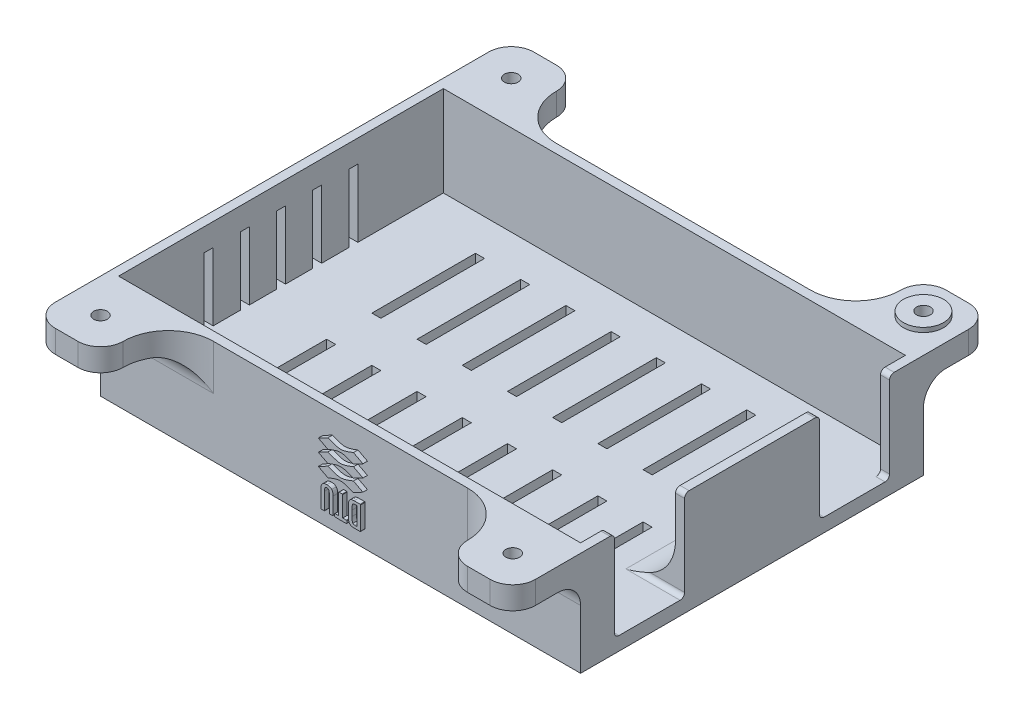
from build123d import *
from OCP.BRepFilletAPI import BRepFilletAPI_MakeFillet

# Parameters (mm, degrees)
SKETCH1_W               = 106.2
SKETCH1_H               = 75.85
BOSS_EXTRUDE1_DEPTH     = 23
SKETCH5_W               = 15
SKETCH5_H               = 15
FEET_DEPTH              = 5
SKETCH2_W               = 102.2
SKETCH2_H               = 71.85
CUT_EXTRUDE1_DEPTH      = 20
LEFTHOLESSKETCH_W       = 15.5
LEFTHOLESSKETCH_H       = 20
LEFTHOLES_DEPTH         = 2
RIGHTHOLESSKETCH_W      = 2
RIGHTHOLESSKETCH_H      = 15
RIGHTHOLES_DEPTH        = 10
FILLET1_R               = 10
FILLET1_R_2             = 5
SKETCH6_6_R             = 4.45
BOSS_EXTRUDE4_DEPTH     = 1
CUT_EXTRUDE9_DEPTH      = 108.193263345
CUT_EXTRUDE9_DEPTH_BACK = 5
SKETCH6_R               = 1.525
SKETCH7_R               = 3.5
CUT_EXTRUDE10_DEPTH     = 10
SKETCH8_W               = 2
SKETCH8_H               = 22.925
CUT_EXTRUDE11_DEPTH     = 10
FILLET3_R1              = 1
FILLET3_R2              = 10
DTU_SIDE_DEPTH          = 1
BOSS_EXTRUDE6_DEPTH     = 1


with BuildPart() as part:
    # Sketch1 → Boss-Extrude1 (new body)
    with BuildSketch(Plane(origin=(0, 0, 0), x_dir=(1, 0, 0), z_dir=(0, 1, 0))):
        with Locations((-14.601149425, -26.937068966)):
            Rectangle(SKETCH1_W, SKETCH1_H)
    extrude(amount=BOSS_EXTRUDE1_DEPTH)

    # Sketch5 → Feet (add)
    with BuildSketch(Plane.XZ.offset(-23)):
        with Locations((30.998850575, -18.487931034)):
            Rectangle(SKETCH5_W, SKETCH5_H)
        with Locations((30.998850575, 72.362068966)):
            Rectangle(SKETCH5_W, SKETCH5_H)
        with Locations((-60.201149425, 72.362068966)):
            Rectangle(SKETCH5_W, SKETCH5_H)
        with Locations((-60.201149425, -18.487931034)):
            Rectangle(SKETCH5_W, SKETCH5_H)
    extrude(amount=FEET_DEPTH)

    # Sketch2 → Cut-Extrude1 (cut)
    with BuildSketch(Plane(origin=(0, 23, 0), x_dir=(1, 0, 0), z_dir=(0, 1, 0))):
        with Locations((-14.601149425, -26.937068966)):
            Rectangle(SKETCH2_W, SKETCH2_H)
    extrude(amount=-CUT_EXTRUDE1_DEPTH, mode=Mode.SUBTRACT)

    # LeftHolesSketch → LeftHoles (cut)
    with BuildSketch(Plane(origin=(38.498850575, 0, 0), x_dir=(0, 0, -1), z_dir=(1, 0, 0))):
        with Locations((-49.612068966, 13)):
            Rectangle(LEFTHOLESSKETCH_W, LEFTHOLESSKETCH_H)
        with Locations((-4.262068966, 13)):
            Rectangle(LEFTHOLESSKETCH_W, LEFTHOLESSKETCH_H)
    extrude(amount=-LEFTHOLES_DEPTH, mode=Mode.SUBTRACT)

    # RightHolesSketch → RightHoles (cut)
    with BuildSketch(Plane.ZY.offset(67.701149425)):
        with Locations((34.937068966, 10.5)):
            Rectangle(RIGHTHOLESSKETCH_W, RIGHTHOLESSKETCH_H)
        with Locations((26.937068966, 10.5)):
            Rectangle(RIGHTHOLESSKETCH_W, RIGHTHOLESSKETCH_H)
        with Locations((42.937068966, 10.5)):
            Rectangle(RIGHTHOLESSKETCH_W, RIGHTHOLESSKETCH_H)
        with Locations((18.937068966, 10.5)):
            Rectangle(RIGHTHOLESSKETCH_W, RIGHTHOLESSKETCH_H)
        with Locations((10.937068966, 10.5)):
            Rectangle(RIGHTHOLESSKETCH_W, RIGHTHOLESSKETCH_H)
    extrude(amount=-RIGHTHOLES_DEPTH, mode=Mode.SUBTRACT)

    # Fillet1
    fillet1_edges_1 = [part.edges().sort_by_distance(p)[0] for p in [
        (23.498850575, 20.5, -10.987931034),
        (-52.701149425, 20.5, -10.987931034),
        (-52.701149425, 20.5, 64.862068966),
        (23.498850575, 20.5, 64.862068966),
    ]]
    fillet1_edges_2 = [part.edges().sort_by_distance(p)[0] for p in [
        (23.498850575, 20.5, -25.987931034),
        (38.498850575, 20.5, -25.987931034),
        (-52.701149425, 20.5, 79.862068966),
        (-67.701149425, 20.5, 79.862068966),
        (23.498850575, 20.5, 79.862068966),
        (38.498850575, 20.5, 79.862068966),
        (-52.701149425, 20.5, -25.987931034),
        (-67.701149425, 20.5, -25.987931034),
        (-60.201149425, 18, -10.987931034),
        (30.998850575, 18, -10.987931034),
        (30.998850575, 18, 64.862068966),
        (-60.201149425, 18, 64.862068966),
    ]]
    fillet1 = BRepFilletAPI_MakeFillet(part.part.solid().wrapped)
    for e in fillet1_edges_1:
        fillet1.Add(FILLET1_R - 0.0001, e.wrapped)
    for e in fillet1_edges_2:
        fillet1.Add(FILLET1_R_2 - 0.0001, e.wrapped)
    add(Compound.cast(fillet1.Shape()), mode=Mode.REPLACE)  # a hair under: the kernel refuses the full size

    # Sketch6<6> → Boss-Extrude4 (add)
    with BuildSketch(Plane(origin=(0, 23, 0), x_dir=(-1, 0, 0), z_dir=(0, -1, 0))):
        with Locations(Location((-30.998850575, 18.487931034, 0), (0, 0, 90))):
            Circle(SKETCH6_6_R)
    extrude(amount=-BOSS_EXTRUDE4_DEPTH)

    # Sketch6 → Cut-Extrude9 (cut, two sides: drawn at the far end of the back side and taken through both)
    with BuildSketch(Plane(origin=(0, 23, 0), x_dir=(-1, 0, 0), z_dir=(0, -1, 0)).offset(-CUT_EXTRUDE9_DEPTH_BACK)):
        with Locations(Location((-30.998850575, 18.487931034, 0), (0, 0, 90))):
            Circle(SKETCH6_R)
        with Locations(Location((-30.998850575, -72.362068966, 0), (0, 0, 90))):
            Circle(SKETCH6_R)
        with Locations(Location((60.201149425, -72.362068966, 0), (0, 0, 270))):
            Circle(SKETCH6_R)
        with Locations(Location((60.201149425, 18.487931034, 0), (0, 0, 90))):
            Circle(SKETCH6_R)
    extrude(amount=CUT_EXTRUDE9_DEPTH + CUT_EXTRUDE9_DEPTH_BACK, mode=Mode.SUBTRACT)

    # Sketch7 → Cut-Extrude10 (cut)
    with BuildSketch(Plane.XZ.offset(-18)):
        with Locations((-60.201149425, 72.362068966)):
            Circle(SKETCH7_R)
        with Locations((30.998850575, 72.362068966)):
            Circle(SKETCH7_R)
        with Locations((30.998850575, -18.487931034)):
            Circle(SKETCH7_R)
        with Locations((-60.201149425, -18.487931034)):
            Circle(SKETCH7_R)
    extrude(amount=CUT_EXTRUDE10_DEPTH, mode=Mode.SUBTRACT)

    # Sketch8 → Cut-Extrude11 (cut)
    with BuildSketch(Plane.XZ):
        with Locations((20.398850575, 10.474568966)):
            Rectangle(SKETCH8_W, SKETCH8_H)
        with Locations((10.398850575, 10.474568966)):
            Rectangle(SKETCH8_W, SKETCH8_H)
        with Locations((0.398850575, 10.474568966)):
            Rectangle(SKETCH8_W, SKETCH8_H)
        with Locations((-9.601149425, 10.474568966)):
            Rectangle(SKETCH8_W, SKETCH8_H)
        with Locations((-19.601149425, 10.474568966)):
            Rectangle(SKETCH8_W, SKETCH8_H)
        with Locations((-29.601149425, 10.474568966)):
            Rectangle(SKETCH8_W, SKETCH8_H)
        with Locations((-39.601149425, 10.474568966)):
            Rectangle(SKETCH8_W, SKETCH8_H)
        with Locations((-49.601149425, 10.474568966)):
            Rectangle(SKETCH8_W, SKETCH8_H)
        with Locations((10.398850575, 43.404568966)):
            Rectangle(SKETCH8_W, SKETCH8_H)
        with Locations((0.398850575, 43.404568966)):
            Rectangle(SKETCH8_W, SKETCH8_H)
        with Locations((-9.601149425, 43.404568966)):
            Rectangle(SKETCH8_W, SKETCH8_H)
        with Locations((-19.601149425, 43.404568966)):
            Rectangle(SKETCH8_W, SKETCH8_H)
        with Locations((-29.601149425, 43.404568966)):
            Rectangle(SKETCH8_W, SKETCH8_H)
        with Locations((-39.601149425, 43.404568966)):
            Rectangle(SKETCH8_W, SKETCH8_H)
        with Locations((-49.601149425, 43.404568966)):
            Rectangle(SKETCH8_W, SKETCH8_H)
        with Locations((20.398850575, 43.404568966)):
            Rectangle(SKETCH8_W, SKETCH8_H)
    extrude(amount=-CUT_EXTRUDE11_DEPTH, mode=Mode.SUBTRACT)

    # Fillet3: one fillet with a radius per group of edges: ONE call of the kernel's fillet builder (fillet() takes one radius for all edges)
    fillet3_edges_1 = [part.edges().sort_by_distance(p)[0] for p in [
        (37.498850575, 23, 41.862068966),
        (37.498850575, 3, 41.862068966),
        (37.498850575, 3, 57.362068966),
        (37.498850575, 23, 57.362068966),
        (37.498850575, 3, 12.012068966),
        (37.498850575, 23, 12.012068966),
        (37.498850575, 23, -3.487931034),
        (37.498850575, 3, -3.487931034),
    ]]
    fillet3_edges_2 = [part.edges().sort_by_distance(p)[0] for p in [
        (36.498850575, 3, 26.937068966),
    ]]
    fillet3 = BRepFilletAPI_MakeFillet(part.part.solid().wrapped)
    for e in fillet3_edges_1:
        fillet3.Add(FILLET3_R1, e.wrapped)
    for e in fillet3_edges_2:
        fillet3.Add(FILLET3_R2, e.wrapped)
    add(Compound.cast(fillet3.Shape()), mode=Mode.REPLACE)

    # Sketch9 → DTU-Side (add)
    # profile 1 of 6: a face of its own
    with BuildSketch(Plane(origin=(31.128581926, 28.357931034, 64.862068966), x_dir=(1, 0, 0), z_dir=(0, 0, -1))):
        with BuildLine():
            Line((-47.544621848, 17.835373678), (-49.644090597, 16.732557272))
            Line((-49.644090597, 16.732557272), (-47.544621848, 15.631229147))
            add(Edge.make_bspline(
                [(-47.544621848, 15.631229147), (-44.826524192, 16.688404928), (-44.597080833, 16.688404928), (-41.87799099, 15.631229147)],
                knots=[1, 1, 1, 1, 2, 2, 2, 2], degree=3))
            Line((-41.87799099, 15.631229147), (-39.779018334, 16.732557272))
            Line((-39.779018334, 16.732557272), (-41.87799099, 17.835373678))
            add(Edge.make_bspline(
                [(-41.87799099, 17.835373678), (-44.597080833, 16.777701803), (-44.826524192, 16.777701803), (-47.544621848, 17.835373678)],
                knots=[4, 4, 4, 4, 5, 5, 5, 5], degree=3))
        make_face()
    # profile 2 of 6: a face of its own
    with BuildSketch(Plane(origin=(31.128581926, 28.357931034, 64.862068966), x_dir=(1, 0, 0), z_dir=(0, 0, -1))):
        with BuildLine():
            Line((-47.544621848, 15.110826804), (-49.644090597, 14.009002585))
            Line((-49.644090597, 14.009002585), (-47.544621848, 12.906682273))
            add(Edge.make_bspline(
                [(-47.544621848, 12.906682273), (-44.826524192, 13.964354148), (-44.597080833, 13.964354148), (-41.87799099, 12.906682273)],
                knots=[1, 1, 1, 1, 2, 2, 2, 2], degree=3))
            Line((-41.87799099, 12.906682273), (-39.779018334, 14.009002585))
            Line((-39.779018334, 14.009002585), (-41.87799099, 15.110826804))
            add(Edge.make_bspline(
                [(-41.87799099, 15.110826804), (-44.597080833, 14.053651023), (-44.826524192, 14.053651023), (-47.544621848, 15.110826804)],
                knots=[4, 4, 4, 4, 5, 5, 5, 5], degree=3))
        make_face()
    # profile 3 of 6: a face of its own
    with BuildSketch(Plane(origin=(31.128581926, 28.357931034, 64.862068966), x_dir=(1, 0, 0), z_dir=(0, 0, -1))):
        with BuildLine():
            Line((-47.544621848, 12.386776023), (-49.644090597, 11.284951805))
            Line((-49.644090597, 11.284951805), (-47.544621848, 10.183127586))
            add(Edge.make_bspline(
                [(-47.544621848, 10.183127586), (-44.826524192, 11.240303367), (-44.597080833, 11.240303367), (-41.87799099, 10.183127586)],
                knots=[1, 1, 1, 1, 2, 2, 2, 2], degree=3))
            Line((-41.87799099, 10.183127586), (-39.779018334, 11.284951805))
            Line((-39.779018334, 11.284951805), (-41.87799099, 12.386776023))
            add(Edge.make_bspline(
                [(-41.87799099, 12.386776023), (-44.597080833, 11.329104149), (-44.826524192, 11.329104149), (-47.544621848, 12.386776023)],
                knots=[4, 4, 4, 4, 5, 5, 5, 5], degree=3))
        make_face()
    # profile 4 of 6: a face of its own
    with BuildSketch(Plane(origin=(31.128581926, 28.357931034, 64.862068966), x_dir=(1, 0, 0), z_dir=(0, 0, -1))):
        with BuildLine():
            Line((-41.723705834, 24.573815083), (-40.414018334, 24.573815083))
            add(Edge.make_bspline(
                [(-40.414018334, 24.573815083), (-40.374826928, 24.573815083), (-40.350766381, 24.561908833), (-40.333155053, 24.545041645)],
                knots=[0, 0, 0, 0, 1, 1, 1, 1], degree=3))
            add(Edge.make_bspline(
                [(-40.333155053, 24.545041645), (-40.315791772, 24.52718227), (-40.304381615, 24.503865864), (-40.304381615, 24.464178364)],
                knots=[1, 1, 1, 1, 2, 2, 2, 2], degree=3))
            Line((-40.304381615, 24.464178364), (-40.304381615, 19.45760024))
            add(Edge.make_bspline(
                [(-40.304381615, 19.45760024), (-40.304381615, 19.418408834), (-40.315791772, 19.394596334), (-40.333155053, 19.377233053)],
                knots=[3, 3, 3, 3, 4, 4, 4, 4], degree=3))
            add(Edge.make_bspline(
                [(-40.333155053, 19.377233053), (-40.350766381, 19.359869772), (-40.374826928, 19.347963522), (-40.414018334, 19.347963522)],
                knots=[4, 4, 4, 4, 5, 5, 5, 5], degree=3))
            Line((-40.414018334, 19.347963522), (-41.723705834, 19.347963522))
            add(Edge.make_bspline(
                [(-41.723705834, 19.347963522), (-42.232449974, 19.347963522), (-42.542756615, 19.463553365), (-42.730776146, 19.707135396)],
                knots=[6, 6, 6, 6, 7, 7, 7, 7], degree=3))
            add(Edge.make_bspline(
                [(-42.730776146, 19.707135396), (-43.008340599, 20.039518209), (-43.017270286, 20.576291646), (-43.017270286, 21.399311177)],
                knots=[7, 7, 7, 7, 8, 8, 8, 8], degree=3))
            Line((-43.017270286, 21.399311177), (-43.017270286, 22.522467427))
            add(Edge.make_bspline(
                [(-43.017270286, 22.522467427), (-43.017270286, 23.345486958), (-43.008340599, 23.882260395), (-42.730776146, 24.214643208)],
                knots=[9, 9, 9, 9, 10, 10, 10, 10], degree=3))
            add(Edge.make_bspline(
                [(-42.730776146, 24.214643208), (-42.542756615, 24.458225239), (-42.232449974, 24.573815083), (-41.723705834, 24.573815083)],
                knots=[10, 10, 10, 10, 11, 11, 11, 11], degree=3))
        make_face()
        with BuildLine():
            Line((-41.135338646, 19.959151021), (-41.135338646, 23.963123677))
            Line((-41.135338646, 23.963123677), (-41.597201927, 23.963123677))
            add(Edge.make_bspline(
                [(-41.597201927, 23.963123677), (-41.801096459, 23.963123677), (-41.922887474, 23.929885395), (-42.017145287, 23.81677602)],
                knots=[1, 1, 1, 1, 2, 2, 2, 2], degree=3))
            add(Edge.make_bspline(
                [(-42.017145287, 23.81677602), (-42.162500755, 23.64215102), (-42.174903099, 23.289924458), (-42.174903099, 22.580014302)],
                knots=[2, 2, 2, 2, 3, 3, 3, 3], degree=3))
            Line((-42.174903099, 22.580014302), (-42.174903099, 21.341764302))
            add(Edge.make_bspline(
                [(-42.174903099, 21.341764302), (-42.174903099, 20.631854146), (-42.162500755, 20.279627584), (-42.017145287, 20.105002584)],
                knots=[4, 4, 4, 4, 5, 5, 5, 5], degree=3))
            add(Edge.make_bspline(
                [(-42.017145287, 20.105002584), (-41.922887474, 19.991893209), (-41.801096459, 19.959151021), (-41.597201927, 19.959151021)],
                knots=[5, 5, 5, 5, 6, 6, 6, 6], degree=3))
            Line((-41.597201927, 19.959151021), (-41.135338646, 19.959151021))
        make_face(mode=Mode.SUBTRACT)
    # profile 5 of 6: a face of its own
    with BuildSketch(Plane(origin=(31.128581926, 28.357931034, 64.862068966), x_dir=(1, 0, 0), z_dir=(0, 0, -1))):
        with BuildLine():
            Line((-49.089953879, 20.766791646), (-49.089953879, 24.464178364))
            add(Edge.make_bspline(
                [(-49.089953879, 24.464178364), (-49.089953879, 24.503865864), (-49.078047629, 24.52718227), (-49.060684347, 24.545041645)],
                knots=[0, 0, 0, 0, 1, 1, 1, 1], degree=3))
            add(Edge.make_bspline(
                [(-49.060684347, 24.545041645), (-49.043569113, 24.561908833), (-49.019260519, 24.573815083), (-48.98031716, 24.573815083)],
                knots=[1, 1, 1, 1, 2, 2, 2, 2], degree=3))
            Line((-48.98031716, 24.573815083), (-48.368137473, 24.573815083))
            add(Edge.make_bspline(
                [(-48.368137473, 24.573815083), (-48.328946066, 24.573815083), (-48.305133566, 24.561908833), (-48.287770285, 24.545041645)],
                knots=[3, 3, 3, 3, 4, 4, 4, 4], degree=3))
            add(Edge.make_bspline(
                [(-48.287770285, 24.545041645), (-48.270158957, 24.52718227), (-48.258500754, 24.503865864), (-48.258500754, 24.464178364)],
                knots=[4, 4, 4, 4, 5, 5, 5, 5], degree=3))
            Line((-48.258500754, 24.464178364), (-48.258500754, 20.767783834))
            add(Edge.make_bspline(
                [(-48.258500754, 20.767783834), (-48.258500754, 20.38231899), (-48.229231223, 20.153123678), (-48.104215598, 20.015209615)],
                knots=[6, 6, 6, 6, 7, 7, 7, 7], degree=3))
            add(Edge.make_bspline(
                [(-48.104215598, 20.015209615), (-48.01913552, 19.92194399), (-47.898584738, 19.876303365), (-47.730408957, 19.876303365)],
                knots=[7, 7, 7, 7, 8, 8, 8, 8], degree=3))
            add(Edge.make_bspline(
                [(-47.730408957, 19.876303365), (-47.577115988, 19.876303365), (-47.461526145, 19.918967428), (-47.373221457, 20.016201803)],
                knots=[8, 8, 8, 8, 9, 9, 9, 9], degree=3))
            add(Edge.make_bspline(
                [(-47.373221457, 20.016201803), (-47.254655051, 20.146674459), (-47.218688254, 20.368428365), (-47.218688254, 20.767783834)],
                knots=[9, 9, 9, 9, 10, 10, 10, 10], degree=3))
            Line((-47.218688254, 20.767783834), (-47.218688254, 24.464178364))
            add(Edge.make_bspline(
                [(-47.218688254, 24.464178364), (-47.218688254, 24.503865864), (-47.206533957, 24.52718227), (-47.188922629, 24.545041645)],
                knots=[11, 11, 11, 11, 12, 12, 12, 12], degree=3))
            add(Edge.make_bspline(
                [(-47.188922629, 24.545041645), (-47.172055442, 24.561908833), (-47.147994895, 24.573815083), (-47.108555442, 24.573815083)],
                knots=[12, 12, 12, 12, 13, 13, 13, 13], degree=3))
            Line((-47.108555442, 24.573815083), (-46.496871848, 24.573815083))
            add(Edge.make_bspline(
                [(-46.496871848, 24.573815083), (-46.457432395, 24.573815083), (-46.433371848, 24.561908833), (-46.416504661, 24.545041645)],
                knots=[14, 14, 14, 14, 15, 15, 15, 15], degree=3))
            add(Edge.make_bspline(
                [(-46.416504661, 24.545041645), (-46.398645286, 24.52718227), (-46.387235129, 24.503865864), (-46.387235129, 24.464178364)],
                knots=[15, 15, 15, 15, 16, 16, 16, 16], degree=3))
            Line((-46.387235129, 24.464178364), (-46.387235129, 20.766791646))
            add(Edge.make_bspline(
                [(-46.387235129, 20.766791646), (-46.387235129, 20.228529928), (-46.460408957, 19.891186178), (-46.674225364, 19.65603774)],
                knots=[17, 17, 17, 17, 18, 18, 18, 18], degree=3))
            add(Edge.make_bspline(
                [(-46.674225364, 19.65603774), (-46.896227317, 19.411463522), (-47.232330832, 19.281983053), (-47.741074973, 19.281983053)],
                knots=[18, 18, 18, 18, 19, 19, 19, 19], degree=3))
            add(Edge.make_bspline(
                [(-47.741074973, 19.281983053), (-48.255772238, 19.281983053), (-48.587162863, 19.419897115), (-48.791057394, 19.656533834)],
                knots=[19, 19, 19, 19, 20, 20, 20, 20], degree=3))
            add(Edge.make_bspline(
                [(-48.791057394, 19.656533834), (-49.030670676, 19.934842428), (-49.089953879, 20.26722524), (-49.089953879, 20.766791646)],
                knots=[20, 20, 20, 20, 21, 21, 21, 21], degree=3))
        make_face()
    # profile 6 of 6: a face of its own
    with BuildSketch(Plane(origin=(31.128581926, 28.357931034, 64.862068966), x_dir=(1, 0, 0), z_dir=(0, 0, -1))):
        with BuildLine():
            Line((-45.138071067, 23.913514302), (-45.138071067, 19.45760024))
            add(Edge.make_bspline(
                [(-45.138071067, 19.45760024), (-45.138071067, 19.418408834), (-45.126660911, 19.394596334), (-45.10929763, 19.377233053)],
                knots=[0, 0, 0, 0, 1, 1, 1, 1], degree=3))
            add(Edge.make_bspline(
                [(-45.10929763, 19.377233053), (-45.091686302, 19.359869772), (-45.067873802, 19.347963522), (-45.028930442, 19.347963522)],
                knots=[1, 1, 1, 1, 2, 2, 2, 2], degree=3))
            Line((-45.028930442, 19.347963522), (-44.358955833, 19.347963522))
            add(Edge.make_bspline(
                [(-44.358955833, 19.347963522), (-44.320012474, 19.347963522), (-44.29570388, 19.359869772), (-44.278588646, 19.377233053)],
                knots=[3, 3, 3, 3, 4, 4, 4, 4], degree=3))
            add(Edge.make_bspline(
                [(-44.278588646, 19.377233053), (-44.260729271, 19.394596334), (-44.249319114, 19.418408834), (-44.249319114, 19.45760024)],
                knots=[4, 4, 4, 4, 5, 5, 5, 5], degree=3))
            Line((-44.249319114, 19.45760024), (-44.249319114, 23.913514302))
            Line((-44.249319114, 23.913514302), (-43.463258568, 23.913514302))
            add(Edge.make_bspline(
                [(-43.463258568, 23.913514302), (-43.423819114, 23.913514302), (-43.400254661, 23.924924458), (-43.382395286, 23.942287739)],
                knots=[7, 7, 7, 7, 8, 8, 8, 8], degree=3))
            add(Edge.make_bspline(
                [(-43.382395286, 23.942287739), (-43.365032005, 23.95965102), (-43.353125755, 23.983959614), (-43.353125755, 24.02315102)],
                knots=[8, 8, 8, 8, 9, 9, 9, 9], degree=3))
            Line((-43.353125755, 24.02315102), (-43.353125755, 24.464178364))
            add(Edge.make_bspline(
                [(-43.353125755, 24.464178364), (-43.353125755, 24.503865864), (-43.365032005, 24.52718227), (-43.382395286, 24.545041645)],
                knots=[10, 10, 10, 10, 11, 11, 11, 11], degree=3))
            add(Edge.make_bspline(
                [(-43.382395286, 24.545041645), (-43.400254661, 24.561908833), (-43.423819114, 24.573815083), (-43.463258568, 24.573815083)],
                knots=[11, 11, 11, 11, 12, 12, 12, 12], degree=3))
            Line((-43.463258568, 24.573815083), (-45.924379661, 24.573815083))
            add(Edge.make_bspline(
                [(-45.924379661, 24.573815083), (-45.963819114, 24.573815083), (-45.987879661, 24.561908833), (-46.005490989, 24.545041645)],
                knots=[13, 13, 13, 13, 14, 14, 14, 14], degree=3))
            add(Edge.make_bspline(
                [(-46.005490989, 24.545041645), (-46.022110129, 24.52718227), (-46.034264426, 24.503865864), (-46.034264426, 24.464178364)],
                knots=[14, 14, 14, 14, 15, 15, 15, 15], degree=3))
            Line((-46.034264426, 24.464178364), (-46.034264426, 24.02315102))
            add(Edge.make_bspline(
                [(-46.034264426, 24.02315102), (-46.034264426, 23.983959614), (-46.022110129, 23.95965102), (-46.005490989, 23.942287739)],
                knots=[16, 16, 16, 16, 17, 17, 17, 17], degree=3))
            add(Edge.make_bspline(
                [(-46.005490989, 23.942287739), (-45.987879661, 23.924924458), (-45.963819114, 23.913514302), (-45.924379661, 23.913514302)],
                knots=[17, 17, 17, 17, 18, 18, 18, 18], degree=3))
            Line((-45.924379661, 23.913514302), (-45.138071067, 23.913514302))
        make_face()
    extrude(amount=-DTU_SIDE_DEPTH)

    # Sketch10 → Boss-Extrude6 (add)
    # profile 1 of 4: a face of its own
    with BuildSketch(Plane(origin=(0, 0, -10.987931034), x_dir=(-1, 0, 0), z_dir=(0, 0, -1))):
        with BuildLine():
            Line((24.124226348, 11.540502287), (22.993417053, 11.540502287))
            add(Edge.make_bspline(
                [(22.993417053, 11.540502287), (22.905257462, 11.539886021), (22.734843976, 11.538694773), (22.487948548, 11.525272266), (22.258367217, 11.504629403), (22.045951992, 11.476231405), (21.851138358, 11.438653076), (21.674177523, 11.391518428), (21.514475564, 11.337109318), (21.370281383, 11.273085959), (21.238645964, 11.198441081), (21.113653933, 11.11529268), (20.995550708, 11.020594787), (20.882678897, 10.916174313), (20.776495136, 10.800120917), (20.675231083, 10.674356864), (20.581366144, 10.537058402), (20.492062982, 10.391517515), (20.411300156, 10.237117414), (20.340855801, 10.075172321), (20.281844138, 9.906724414), (20.233894106, 9.73159417), (20.195672396, 9.550362968), (20.168929436, 9.362665102), (20.152396672, 9.168674347), (20.150719561, 9.037197287), (20.149867374, 8.970390107)],
                knots=[0, 0, 0, 0, 1.44355588, 2.790409838, 4.047694926, 5.217575253, 6.298404546, 7.294384826, 8.214239204, 9.058592145, 9.873746385, 10.689560431, 11.514393297, 12.350027578, 13.205127629, 14.088021785, 14.991911688, 15.926770944, 16.882954281, 17.842803888, 18.816321264, 19.80318086, 20.814351908, 21.847355356, 22.906180909, 24, 24, 24, 24], degree=3))
            add(Edge.make_bspline(
                [(20.149867374, 8.970390107), (20.15209886, 8.876120828), (20.156491669, 8.690546234), (20.193494246, 8.418217655), (20.253339941, 8.15716355), (20.337488424, 7.909425986), (20.441810017, 7.677211102), (20.566433842, 7.464613911), (20.709532623, 7.272775526), (20.869439251, 7.102651146), (21.042579183, 6.956426936), (21.222506487, 6.8311966), (21.410973982, 6.732442031), (21.577040185, 6.669816866), (21.7210403, 6.630869432), (21.847470843, 6.607851123), (21.99108304, 6.586741946), (22.15321595, 6.570429227), (22.333158331, 6.555882292), (22.531627435, 6.547978053), (22.747980676, 6.541410804), (22.898258459, 6.540813061), (22.97638981, 6.540502287)],
                knots=[0, 0, 0, 0, 1.315458931, 2.589557908, 3.828601765, 5.048913369, 6.235739168, 7.376350998, 8.481830359, 9.569842114, 10.627874879, 11.640079404, 12.624025415, 13.590060155, 14.111227486, 14.704434459, 15.382649715, 16.137166398, 16.978595427, 17.902333227, 18.909396075, 20, 20, 20, 20], degree=3))
            Line((22.97638981, 6.540502287), (24.124226348, 6.540502287))
            Line((24.124226348, 6.540502287), (24.124226348, 11.540502287))
        make_face()
        with BuildLine():
            Line((23.226790451, 10.64306639), (23.226790451, 7.437938184))
            Line((23.226790451, 7.437938184), (22.758040451, 7.437938184))
            add(Edge.make_bspline(
                [(22.758040451, 7.437938184), (22.7022664, 7.438040386), (22.594994332, 7.438236952), (22.440117749, 7.447599601), (22.296896179, 7.456997118), (22.165723879, 7.474833919), (22.045646217, 7.494702861), (21.938312746, 7.522353214), (21.841510856, 7.551397567), (21.756422965, 7.588374629), (21.678489389, 7.629994773), (21.606331799, 7.678757597), (21.536679523, 7.732906873), (21.470834765, 7.79403521), (21.408548319, 7.861333154), (21.350188712, 7.935147459), (21.294976995, 8.015252918), (21.244330351, 8.102073068), (21.198049177, 8.194691067), (21.156992589, 8.292209776), (21.122950619, 8.395441316), (21.094657018, 8.503419315), (21.074438032, 8.617083844), (21.057710677, 8.735593006), (21.049087238, 8.859416324), (21.047903725, 8.943669847), (21.047303271, 8.986415749)],
                knots=[0, 0, 0, 0, 1.50275155, 2.890291501, 4.180787663, 5.369391935, 6.45668281, 7.458360028, 8.354766181, 9.177074746, 9.954075863, 10.732690366, 11.5210699, 12.329727389, 13.151100085, 13.990027547, 14.863562427, 15.770965086, 16.696477834, 17.652329173, 18.619756807, 19.62365428, 20.657822005, 21.729286259, 22.847956731, 24, 24, 24, 24], degree=3))
            add(Edge.make_bspline(
                [(21.047303271, 8.986415749), (21.048499171, 9.051919801), (21.050831083, 9.179647628), (21.073319539, 9.365685996), (21.109926456, 9.540868989), (21.162160998, 9.704546457), (21.228004258, 9.857178418), (21.310422446, 9.997471757), (21.4058686, 10.127783209), (21.481344816, 10.204228087), (21.519058079, 10.242425364)],
                knots=[0, 0, 0, 0, 1.13821349, 2.219428113, 3.251817212, 4.244760574, 5.201143372, 6.134805572, 7.068016741, 8, 8, 8, 8], degree=3))
            add(Edge.make_bspline(
                [(21.519058079, 10.242425364), (21.556246928, 10.274974607), (21.632200941, 10.341452751), (21.765551227, 10.421110568), (21.912496337, 10.491097769), (22.076397932, 10.546589813), (22.255671979, 10.590475288), (22.451386235, 10.620742027), (22.662492609, 10.640191112), (22.808742186, 10.64208743), (22.884242374, 10.64306639)],
                knots=[0, 0, 0, 0, 0.813307809, 1.661089106, 2.549956539, 3.493439533, 4.508053171, 5.589449661, 6.755572447, 8, 8, 8, 8], degree=3))
            Line((22.884242374, 10.64306639), (23.226790451, 10.64306639))
        make_face(mode=Mode.SUBTRACT)
    # profile 2 of 4: a face of its own
    with BuildSketch(Plane(origin=(0, 0, -10.987931034), x_dir=(-1, 0, 0), z_dir=(0, 0, -1))):
        with BuildLine():
            Line((14.765251989, 10.673114466), (15.423304874, 10.044108056))
            add(Edge.make_bspline(
                [(15.423304874, 10.044108056), (15.479126281, 10.101827484), (15.588162976, 10.21457161), (15.763862126, 10.363834897), (15.946582845, 10.488225651), (16.132770665, 10.592986752), (16.325774567, 10.672245991), (16.523362899, 10.730003533), (16.726797321, 10.765216124), (16.864473913, 10.769245067), (16.933721541, 10.771271518)],
                knots=[0, 0, 0, 0, 1.115251505, 2.178435587, 3.19620269, 4.182487026, 5.141301733, 6.088180966, 7.038406374, 8, 8, 8, 8], degree=3))
            add(Edge.make_bspline(
                [(16.933721541, 10.771271518), (16.991551725, 10.769670551), (17.105673223, 10.76651122), (17.273233487, 10.743350205), (17.43351354, 10.703963892), (17.587062044, 10.649682257), (17.733427178, 10.579444702), (17.872915814, 10.493305589), (18.005184048, 10.392042877), (18.128484693, 10.276180504), (18.241275791, 10.149592155), (18.340933907, 10.014522688), (18.424413566, 9.871281541), (18.492923964, 9.721319354), (18.546290915, 9.563942027), (18.584401623, 9.399255515), (18.606443839, 9.227063687), (18.609733787, 9.110008966), (18.611405836, 9.050518313)],
                knots=[0, 0, 0, 0, 1.035432265, 2.043311493, 3.022114605, 3.98653278, 4.95457646, 5.923598177, 6.917315552, 7.932509744, 8.948865224, 9.949768934, 10.933144597, 11.912367597, 12.897413939, 13.903909035, 14.934704909, 16, 16, 16, 16], degree=3))
            add(Edge.make_bspline(
                [(18.611405836, 9.050518313), (18.61092397, 9.00876361), (18.609974204, 8.926464233), (18.59957733, 8.804720613), (18.582835913, 8.686600521), (18.558606934, 8.572282875), (18.528308357, 8.461668609), (18.492761228, 8.353803458), (18.448167877, 8.250177875), (18.398668585, 8.149588318), (18.341101479, 8.054779497), (18.279033519, 7.964371417), (18.21173095, 7.878807251), (18.138757849, 7.798436787), (18.05908721, 7.724516036), (17.974778226, 7.654822112), (17.88440872, 7.59109969), (17.789855895, 7.531749586), (17.690302935, 7.480191647), (17.588450942, 7.433490114), (17.482755636, 7.395561525), (17.374503919, 7.364987623), (17.264082645, 7.338989085), (17.150411792, 7.322980987), (17.034476743, 7.310858241), (16.95612411, 7.310109732), (16.916694297, 7.309733056)],
                knots=[0, 0, 0, 0, 1.103660481, 2.175337485, 3.227646561, 4.255952547, 5.262355991, 6.258840057, 7.255597736, 8.242457506, 9.22035537, 10.185017736, 11.140346927, 12.096287581, 13.051739095, 14.01125915, 14.986044842, 15.97314143, 16.960198552, 17.947847494, 18.933482797, 19.925264591, 20.920966487, 21.929612487, 22.958107872, 24, 24, 24, 24], degree=3))
            add(Edge.make_bspline(
                [(16.916694297, 7.309733056), (16.849814559, 7.311667573), (16.718413264, 7.315468396), (16.52556297, 7.345190292), (16.341795853, 7.394081128), (16.194966805, 7.451818365), (16.079930125, 7.508834636), (15.9923544, 7.56157188), (15.901794276, 7.620564276), (15.809753878, 7.688038263), (15.715197933, 7.763184126), (15.619795573, 7.847647699), (15.521104481, 7.938647718), (15.456452924, 8.003596219), (15.423304874, 8.036896518)],
                knots=[0, 0, 0, 0, 1.404581149, 2.759636711, 4.088442092, 5.392261763, 6.066678138, 6.783632037, 7.538459478, 8.336747902, 9.180226004, 10.074962426, 11.012997595, 12, 12, 12, 12], degree=3))
            Line((15.423304874, 8.036896518), (14.785284041, 7.366824402))
            add(Edge.make_bspline(
                [(14.785284041, 7.366824402), (14.830133471, 7.323523685), (14.917669968, 7.239009946), (15.049716343, 7.119008322), (15.181596533, 7.011173523), (15.310124586, 6.911591618), (15.437405927, 6.823163671), (15.563427057, 6.745801365), (15.686761362, 6.677548099), (15.809969919, 6.619554928), (15.933819394, 6.570312703), (16.06124595, 6.527918379), (16.192639141, 6.492054307), (16.328801458, 6.46311671), (16.46846286, 6.439912664), (16.612930394, 6.424250068), (16.761288063, 6.413720625), (16.861921369, 6.412774467), (16.912687887, 6.412297159)],
                knots=[0, 0, 0, 0, 1.244526981, 2.429050516, 3.560637417, 4.644440555, 5.67424972, 6.652764056, 7.595344123, 8.486817594, 9.369275933, 10.254498637, 11.166417451, 12.086725134, 13.032340136, 13.991389299, 14.986715468, 16, 16, 16, 16], degree=3))
            add(Edge.make_bspline(
                [(16.912687887, 6.412297159), (17.005939692, 6.414674333), (17.188407555, 6.419325803), (17.45580945, 6.453790044), (17.709834073, 6.511568738), (17.951099417, 6.593283747), (18.179528766, 6.697670841), (18.395063681, 6.825644517), (18.597356767, 6.976864769), (18.784773894, 7.149559148), (18.954301605, 7.340285593), (19.104144469, 7.54507347), (19.228094492, 7.764929238), (19.331012867, 7.996604924), (19.411493683, 8.241157755), (19.468138534, 8.498852262), (19.503070999, 8.769439625), (19.506892661, 8.954257031), (19.508841733, 9.048515107)],
                knots=[0, 0, 0, 0, 1.078019885, 2.10938526, 3.111377082, 4.085535484, 5.04941344, 6.010039228, 6.978205633, 7.964457913, 8.951525778, 9.924444315, 10.892603023, 11.863865945, 12.85144698, 13.863884204, 14.910567087, 16, 16, 16, 16], degree=3))
            add(Edge.make_bspline(
                [(19.508841733, 9.048515107), (19.50801815, 9.109989421), (19.506386009, 9.231816484), (19.489232055, 9.411277619), (19.465318447, 9.586220125), (19.427381681, 9.754827519), (19.381652652, 9.919371254), (19.324782597, 10.078062931), (19.256862344, 10.231358646), (19.180081123, 10.379515026), (19.093219296, 10.521561487), (18.9961851, 10.656277626), (18.891476573, 10.784703428), (18.77657774, 10.905135085), (18.653158232, 11.018630011), (18.520660823, 11.124573156), (18.379882419, 11.224483863), (18.230441986, 11.315785677), (18.075242753, 11.398373021), (17.91624219, 11.471218586), (17.753830944, 11.532100703), (17.588695704, 11.582600174), (17.420138776, 11.620294457), (17.249363276, 11.648827814), (17.07491611, 11.664778143), (16.95778995, 11.667389314), (16.898665451, 11.668707415)],
                knots=[0, 0, 0, 0, 1.071919942, 2.124283339, 3.142214191, 4.149696895, 5.136002878, 6.119640489, 7.086990633, 8.058538607, 9.028339693, 9.988281803, 10.952401235, 11.916291999, 12.888973767, 13.874849856, 14.873389453, 15.898127285, 16.927174885, 17.938320013, 18.946391617, 19.950418109, 20.947802303, 21.956882652, 22.968648068, 24, 24, 24, 24], degree=3))
            add(Edge.make_bspline(
                [(16.898665451, 11.668707415), (16.848226191, 11.667951847), (16.747872098, 11.666448565), (16.598428014, 11.653917079), (16.450179113, 11.634236506), (16.303656173, 11.604542713), (16.157811112, 11.569292428), (16.014560496, 11.523137043), (15.871644471, 11.471688168), (15.731304461, 11.410191543), (15.593344573, 11.343062422), (15.460996735, 11.266901997), (15.332038837, 11.186397094), (15.209328511, 11.096783081), (15.090567127, 11.001310426), (14.976375699, 10.899533693), (14.867756324, 10.789755967), (14.799592835, 10.712191524), (14.765251989, 10.673114466)],
                knots=[0, 0, 0, 0, 0.996412454, 1.982464992, 2.961075852, 3.949442424, 4.934965278, 5.923860011, 6.921385422, 7.934793307, 8.949617135, 9.951082467, 10.950285876, 11.951772932, 12.951063433, 13.960125323, 14.972308753, 16, 16, 16, 16], degree=3))
        make_face()
    # profile 3 of 4: a face of its own
    with BuildSketch(Plane(origin=(0, 0, -10.987931034), x_dir=(-1, 0, 0), z_dir=(0, 0, -1))):
        with BuildLine():
            Line((13.867816092, 11.540502287), (12.737006797, 11.540502287))
            add(Edge.make_bspline(
                [(12.737006797, 11.540502287), (12.648847206, 11.539886021), (12.478433719, 11.538694773), (12.231538291, 11.525272266), (12.001956961, 11.504629403), (11.789541736, 11.476231405), (11.594728102, 11.438653076), (11.417767267, 11.391518428), (11.258065308, 11.337109318), (11.113871126, 11.273085959), (10.982235707, 11.198441081), (10.857243676, 11.11529268), (10.739140451, 11.020594787), (10.626268641, 10.916174313), (10.520084879, 10.800120917), (10.418820827, 10.674356864), (10.324955887, 10.537058402), (10.235652726, 10.391517515), (10.1548899, 10.237117414), (10.084445545, 10.075172321), (10.025433881, 9.906724414), (9.977483849, 9.73159417), (9.939262139, 9.550362968), (9.91251918, 9.362665102), (9.895986415, 9.168674347), (9.894309305, 9.037197287), (9.893457118, 8.970390107)],
                knots=[0, 0, 0, 0, 1.44355588, 2.790409838, 4.047694926, 5.217575253, 6.298404546, 7.294384826, 8.214239204, 9.058592145, 9.873746385, 10.689560431, 11.514393297, 12.350027578, 13.205127629, 14.088021785, 14.991911688, 15.926770944, 16.882954281, 17.842803888, 18.816321264, 19.80318086, 20.814351908, 21.847355356, 22.906180909, 24, 24, 24, 24], degree=3))
            add(Edge.make_bspline(
                [(9.893457118, 8.970390107), (9.895688603, 8.876120828), (9.900081413, 8.690546234), (9.93708399, 8.418217655), (9.996929685, 8.15716355), (10.081078168, 7.909425986), (10.185399761, 7.677211102), (10.310023586, 7.464613911), (10.453122366, 7.272775526), (10.613028994, 7.102651146), (10.786168927, 6.956426936), (10.966096231, 6.8311966), (11.154563726, 6.732442031), (11.320629928, 6.669816866), (11.464630043, 6.630869432), (11.591060587, 6.607851123), (11.734672784, 6.586741946), (11.896805694, 6.570429227), (12.076748074, 6.555882292), (12.275217178, 6.547978053), (12.49157042, 6.541410804), (12.641848202, 6.540813061), (12.719979553, 6.540502287)],
                knots=[0, 0, 0, 0, 1.315458931, 2.589557908, 3.828601765, 5.048913369, 6.235739168, 7.376350998, 8.481830359, 9.569842114, 10.627874879, 11.640079404, 12.624025415, 13.590060155, 14.111227486, 14.704434459, 15.382649715, 16.137166398, 16.978595427, 17.902333227, 18.909396075, 20, 20, 20, 20], degree=3))
            Line((12.719979553, 6.540502287), (13.867816092, 6.540502287))
            Line((13.867816092, 6.540502287), (13.867816092, 11.540502287))
        make_face()
        with BuildLine():
            Line((12.970380195, 10.64306639), (12.970380195, 7.437938184))
            Line((12.970380195, 7.437938184), (12.501630195, 7.437938184))
            add(Edge.make_bspline(
                [(12.501630195, 7.437938184), (12.445856143, 7.438040386), (12.338584076, 7.438236952), (12.183707492, 7.447599601), (12.040485923, 7.456997118), (11.909313623, 7.474833919), (11.789235961, 7.494702861), (11.68190249, 7.522353214), (11.5851006, 7.551397567), (11.500012708, 7.588374629), (11.422079132, 7.629994773), (11.349921543, 7.678757597), (11.280269267, 7.732906873), (11.214424509, 7.79403521), (11.152138063, 7.861333154), (11.093778455, 7.935147459), (11.038566739, 8.015252918), (10.987920095, 8.102073068), (10.94163892, 8.194691067), (10.900582332, 8.292209776), (10.866540363, 8.395441316), (10.838246761, 8.503419315), (10.818027775, 8.617083844), (10.801300421, 8.735593006), (10.792676982, 8.859416324), (10.791493469, 8.943669847), (10.790893015, 8.986415749)],
                knots=[0, 0, 0, 0, 1.50275155, 2.890291501, 4.180787663, 5.369391935, 6.45668281, 7.458360028, 8.354766181, 9.177074746, 9.954075863, 10.732690366, 11.5210699, 12.329727389, 13.151100085, 13.990027547, 14.863562427, 15.770965086, 16.696477834, 17.652329173, 18.619756807, 19.62365428, 20.657822005, 21.729286259, 22.847956731, 24, 24, 24, 24], degree=3))
            add(Edge.make_bspline(
                [(10.790893015, 8.986415749), (10.792088915, 9.051919801), (10.794420827, 9.179647628), (10.816909283, 9.365685996), (10.853516199, 9.540868989), (10.905750742, 9.704546457), (10.971594001, 9.857178418), (11.054012189, 9.997471757), (11.149458344, 10.127783209), (11.224934559, 10.204228087), (11.262647823, 10.242425364)],
                knots=[0, 0, 0, 0, 1.13821349, 2.219428113, 3.251817212, 4.244760574, 5.201143372, 6.134805572, 7.068016741, 8, 8, 8, 8], degree=3))
            add(Edge.make_bspline(
                [(11.262647823, 10.242425364), (11.299836672, 10.274974607), (11.375790684, 10.341452751), (11.509140971, 10.421110568), (11.65608608, 10.491097769), (11.819987676, 10.546589813), (11.999261722, 10.590475288), (12.194975978, 10.620742027), (12.406082353, 10.640191112), (12.55233193, 10.64208743), (12.627832118, 10.64306639)],
                knots=[0, 0, 0, 0, 0.813307809, 1.661089106, 2.549956539, 3.493439533, 4.508053171, 5.589449661, 6.755572447, 8, 8, 8, 8], degree=3))
            Line((12.627832118, 10.64306639), (12.970380195, 10.64306639))
        make_face(mode=Mode.SUBTRACT)
    # profile 4 of 4: a face of its own
    with BuildSketch(Plane(origin=(0, 0, -10.987931034), x_dir=(-1, 0, 0), z_dir=(0, 0, -1))):
        with BuildLine():
            Line((4.508841733, 10.673114466), (5.166894618, 10.044108056))
            add(Edge.make_bspline(
                [(5.166894618, 10.044108056), (5.222716024, 10.101827484), (5.33175272, 10.21457161), (5.50745187, 10.363834897), (5.690172588, 10.488225651), (5.876360409, 10.592986752), (6.069364311, 10.672245991), (6.266952642, 10.730003533), (6.470387064, 10.765216124), (6.608063656, 10.769245067), (6.677311284, 10.771271518)],
                knots=[0, 0, 0, 0, 1.115251505, 2.178435587, 3.19620269, 4.182487026, 5.141301733, 6.088180966, 7.038406374, 8, 8, 8, 8], degree=3))
            add(Edge.make_bspline(
                [(6.677311284, 10.771271518), (6.735141469, 10.769670551), (6.849262967, 10.76651122), (7.016823231, 10.743350205), (7.177103283, 10.703963892), (7.330651788, 10.649682257), (7.477016922, 10.579444702), (7.616505557, 10.493305589), (7.748773791, 10.392042877), (7.872074437, 10.276180504), (7.984865534, 10.149592155), (8.084523651, 10.014522688), (8.168003309, 9.871281541), (8.236513707, 9.721319354), (8.289880659, 9.563942027), (8.327991367, 9.399255515), (8.350033582, 9.227063687), (8.353323531, 9.110008966), (8.354995579, 9.050518313)],
                knots=[0, 0, 0, 0, 1.035432265, 2.043311493, 3.022114605, 3.98653278, 4.95457646, 5.923598177, 6.917315552, 7.932509744, 8.948865224, 9.949768934, 10.933144597, 11.912367597, 12.897413939, 13.903909035, 14.934704909, 16, 16, 16, 16], degree=3))
            add(Edge.make_bspline(
                [(8.354995579, 9.050518313), (8.354513714, 9.00876361), (8.353563947, 8.926464233), (8.343167074, 8.804720613), (8.326425656, 8.686600521), (8.302196677, 8.572282875), (8.271898101, 8.461668609), (8.236350972, 8.353803458), (8.191757621, 8.250177875), (8.142258329, 8.149588318), (8.084691223, 8.054779497), (8.022623262, 7.964371417), (7.955320693, 7.878807251), (7.882347592, 7.798436787), (7.802676954, 7.724516036), (7.718367969, 7.654822112), (7.627998463, 7.59109969), (7.533445638, 7.531749586), (7.433892678, 7.480191647), (7.332040686, 7.433490114), (7.226345379, 7.395561525), (7.118093662, 7.364987623), (7.007672388, 7.338989085), (6.894001535, 7.322980987), (6.778066487, 7.310858241), (6.699713853, 7.310109732), (6.660284041, 7.309733056)],
                knots=[0, 0, 0, 0, 1.103660481, 2.175337485, 3.227646561, 4.255952547, 5.262355991, 6.258840057, 7.255597736, 8.242457506, 9.22035537, 10.185017736, 11.140346927, 12.096287581, 13.051739095, 14.01125915, 14.986044842, 15.97314143, 16.960198552, 17.947847494, 18.933482797, 19.925264591, 20.920966487, 21.929612487, 22.958107872, 24, 24, 24, 24], degree=3))
            add(Edge.make_bspline(
                [(6.660284041, 7.309733056), (6.593404302, 7.311667573), (6.462003007, 7.315468396), (6.269152714, 7.345190292), (6.085385596, 7.394081128), (5.938556549, 7.451818365), (5.823519868, 7.508834636), (5.735944144, 7.56157188), (5.64538402, 7.620564276), (5.553343621, 7.688038263), (5.458787677, 7.763184126), (5.363385317, 7.847647699), (5.264694224, 7.938647718), (5.200042668, 8.003596219), (5.166894618, 8.036896518)],
                knots=[0, 0, 0, 0, 1.404581149, 2.759636711, 4.088442092, 5.392261763, 6.066678138, 6.783632037, 7.538459478, 8.336747902, 9.180226004, 10.074962426, 11.012997595, 12, 12, 12, 12], degree=3))
            Line((5.166894618, 8.036896518), (4.528873784, 7.366824402))
            add(Edge.make_bspline(
                [(4.528873784, 7.366824402), (4.573723215, 7.323523685), (4.661259711, 7.239009946), (4.793306087, 7.119008322), (4.925186276, 7.011173523), (5.05371433, 6.911591618), (5.180995671, 6.823163671), (5.307016801, 6.745801365), (5.430351106, 6.677548099), (5.553559663, 6.619554928), (5.677409138, 6.570312703), (5.804835694, 6.527918379), (5.936228885, 6.492054307), (6.072391201, 6.46311671), (6.212052604, 6.439912664), (6.356520137, 6.424250068), (6.504877807, 6.413720625), (6.605511112, 6.412774467), (6.65627763, 6.412297159)],
                knots=[0, 0, 0, 0, 1.244526981, 2.429050516, 3.560637417, 4.644440555, 5.67424972, 6.652764056, 7.595344123, 8.486817594, 9.369275933, 10.254498637, 11.166417451, 12.086725134, 13.032340136, 13.991389299, 14.986715468, 16, 16, 16, 16], degree=3))
            add(Edge.make_bspline(
                [(6.65627763, 6.412297159), (6.749529436, 6.414674333), (6.931997299, 6.419325803), (7.199399194, 6.453790044), (7.453423816, 6.511568738), (7.694689161, 6.593283747), (7.92311851, 6.697670841), (8.138653424, 6.825644517), (8.34094651, 6.976864769), (8.528363637, 7.149559148), (8.697891349, 7.340285593), (8.847734213, 7.54507347), (8.971684236, 7.764929238), (9.074602611, 7.996604924), (9.155083427, 8.241157755), (9.211728277, 8.498852262), (9.246660743, 8.769439625), (9.250482404, 8.954257031), (9.252431477, 9.048515107)],
                knots=[0, 0, 0, 0, 1.078019885, 2.10938526, 3.111377082, 4.085535484, 5.04941344, 6.010039228, 6.978205633, 7.964457913, 8.951525778, 9.924444315, 10.892603023, 11.863865945, 12.85144698, 13.863884204, 14.910567087, 16, 16, 16, 16], degree=3))
            add(Edge.make_bspline(
                [(9.252431477, 9.048515107), (9.251607893, 9.109989421), (9.249975752, 9.231816484), (9.232821799, 9.411277619), (9.20890819, 9.586220125), (9.170971425, 9.754827519), (9.125242396, 9.919371254), (9.06837234, 10.078062931), (9.000452087, 10.231358646), (8.923670867, 10.379515026), (8.83680904, 10.521561487), (8.739774844, 10.656277626), (8.635066317, 10.784703428), (8.520167484, 10.905135085), (8.396747975, 11.018630011), (8.264250566, 11.124573156), (8.123472163, 11.224483863), (7.97403173, 11.315785677), (7.818832496, 11.398373021), (7.659831934, 11.471218586), (7.497420688, 11.532100703), (7.332285448, 11.582600174), (7.163728519, 11.620294457), (6.992953019, 11.648827814), (6.818505853, 11.664778143), (6.701379694, 11.667389314), (6.642255195, 11.668707415)],
                knots=[0, 0, 0, 0, 1.071919942, 2.124283339, 3.142214191, 4.149696895, 5.136002878, 6.119640489, 7.086990633, 8.058538607, 9.028339693, 9.988281803, 10.952401235, 11.916291999, 12.888973767, 13.874849856, 14.873389453, 15.898127285, 16.927174885, 17.938320013, 18.946391617, 19.950418109, 20.947802303, 21.956882652, 22.968648068, 24, 24, 24, 24], degree=3))
            add(Edge.make_bspline(
                [(6.642255195, 11.668707415), (6.591815934, 11.667951847), (6.491461841, 11.666448565), (6.342017757, 11.653917079), (6.193768857, 11.634236506), (6.047245917, 11.604542713), (5.901400855, 11.569292428), (5.75815024, 11.523137043), (5.615234214, 11.471688168), (5.474894205, 11.410191543), (5.336934317, 11.343062422), (5.204586478, 11.266901997), (5.075628581, 11.186397094), (4.952918255, 11.096783081), (4.834156871, 11.001310426), (4.719965443, 10.899533693), (4.611346067, 10.789755967), (4.543182578, 10.712191524), (4.508841733, 10.673114466)],
                knots=[0, 0, 0, 0, 0.996412454, 1.982464992, 2.961075852, 3.949442424, 4.934965278, 5.923860011, 6.921385422, 7.934793307, 8.949617135, 9.951082467, 10.950285876, 11.951772932, 12.951063433, 13.960125323, 14.972308753, 16, 16, 16, 16], degree=3))
        make_face()
    extrude(amount=BOSS_EXTRUDE6_DEPTH)


solid = part.part
